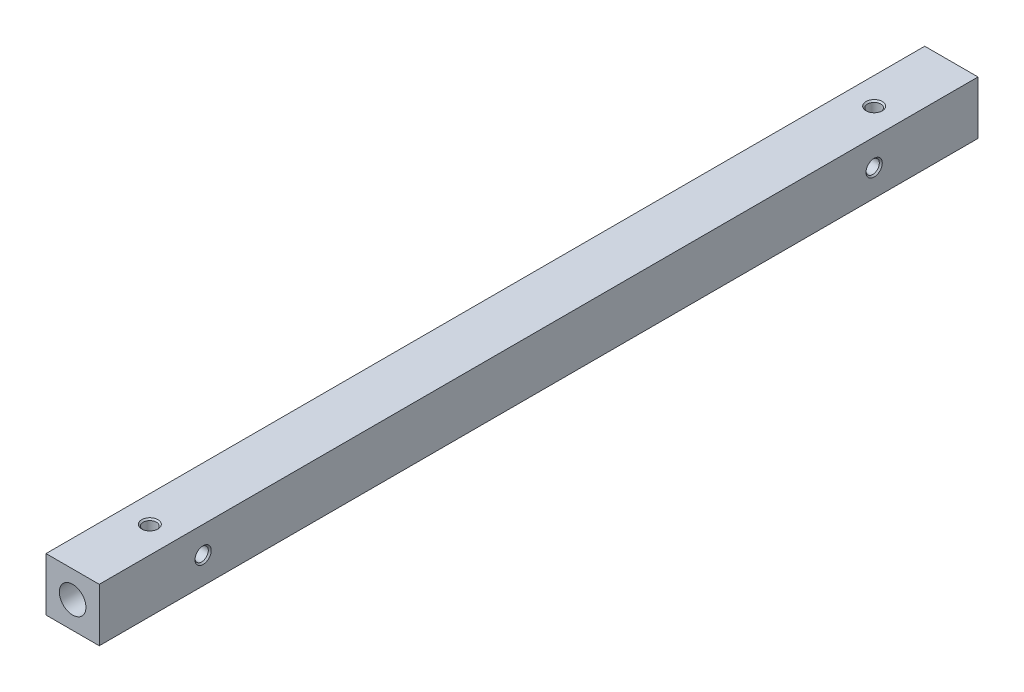
from build123d import *

# Parameters (mm, degrees)
ESQUISSE1_W                     = 10
ESQUISSE1_H                     = 10
BOSS_EXTRU_1_DEPTH              = 82.5
TROU_TARAUD_M3X0_51_D           = 2.5
TROU_TARAUD_M3X0_51_CSINK_D     = 3.05
TROU_TARAUD_M3X0_51_CSINK_ANGLE = 90
TROU_TARAUD_M3X0_52_D           = 2.5
TROU_TARAUD_M3X0_52_CSINK_D     = 3.05
TROU_TARAUD_M3X0_52_CSINK_ANGLE = 90
ESQUISSE6_R                     = 2.5
ENL_V_MAT_EXTRU_1_DEPTH         = 6
ENL_V_START                     = -6
ESQUISSE7_R                     = 2.5
ENL_V_MAT_EXTRU_2_DEPTH         = 6


with BuildPart() as part:
    # Esquisse1 → Boss.-Extru.1 (new, symmetric)
    with BuildSketch(Plane.XY):
        Rectangle(ESQUISSE1_W, ESQUISSE1_H)
    extrude(amount=BOSS_EXTRU_1_DEPTH, both=True)

    # Trou taraudé M3x0.51 (through all)
    with Locations(Plane(origin=(5, 0, 0), x_dir=(0, 0, -1), z_dir=(1, 0, 0))):
        with Locations((63, 0), (-63, 0)):
            CounterSinkHole(TROU_TARAUD_M3X0_51_D / 2, TROU_TARAUD_M3X0_51_CSINK_D / 2, counter_sink_angle=TROU_TARAUD_M3X0_51_CSINK_ANGLE)

    # Trou taraudé M3x0.52 (through all)
    with Locations(Plane(origin=(0, 5, 0), x_dir=(1, 0, 0), z_dir=(0, 1, 0))):
        with Locations((0, 68), (0, -68)):
            CounterSinkHole(TROU_TARAUD_M3X0_52_D / 2, TROU_TARAUD_M3X0_52_CSINK_D / 2, counter_sink_angle=TROU_TARAUD_M3X0_52_CSINK_ANGLE)

    # Esquisse6 → Enlèv. mat.-Extru.1 (cut)
    with BuildSketch(Plane.XY.offset(82.5)):
        Circle(ESQUISSE6_R)
    extrude(amount=-ENL_V_MAT_EXTRU_1_DEPTH, mode=Mode.SUBTRACT)

    # Esquisse7 → Enlèv. mat.-Extru.2 (cut)
    with BuildSketch(Plane(origin=(0, 0, -82.5), x_dir=(-1, 0, 0), z_dir=(0, 0, -1)).offset(ENL_V_START)):
        Circle(ESQUISSE7_R)
    extrude(amount=ENL_V_MAT_EXTRU_2_DEPTH, mode=Mode.SUBTRACT)


solid = part.part
